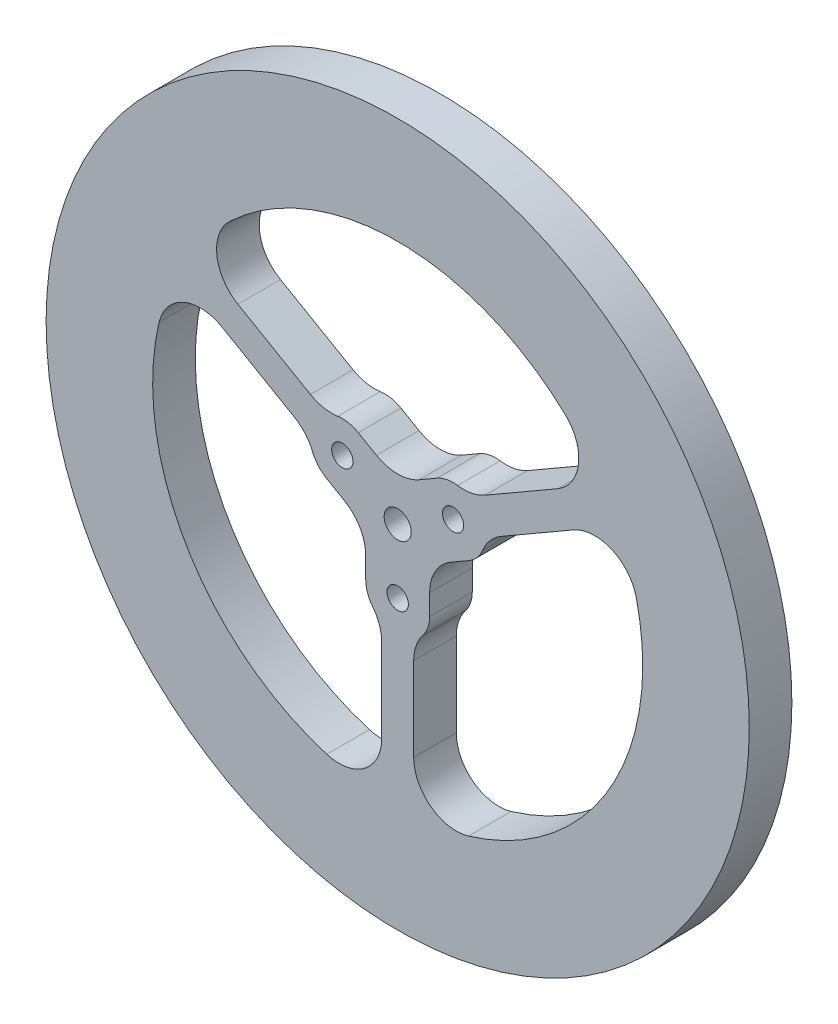
from build123d import *
from build123d.topology import SkipClean

# Parameters (mm, degrees)
BOSS_EXTRUDE1_DEPTH              = 3.175
BOSS_EXTRUDE1_DEPTH_BACK         = 3.175
SKETCH1_R                        = 52.3875
SKETCH1_R_2                      = 2.0193
SHAFT_COUPLER_BOLT_D             = 3.175
SHAFT_COUPLER_BOLT_PATTERN_COUNT = 3
SKETCH6_R                        = 36.5125
CUT_EXTRUDE2_DEPTH               = 2
VOID_CUT_DEPTH                   = 75.214707521
VOID_CUT_DEPTH_BACK              = 75.214707521
TOOLING_RADIUS_R                 = 6.35
BOSS_EXTRUDE2_START              = -4.35
BOSS_EXTRUDE2_DEPTH              = 6.35


# Read off the part's stored shape, not the designer's step: Boss-Extrude2
with BuildPart() as part:
    # Sketch1 → Boss-Extrude1 (new, two sides: drawn at the far end of the back side and taken through both)
    with BuildSketch(Plane.XY.offset(-BOSS_EXTRUDE1_DEPTH_BACK)):
        Circle(SKETCH1_R)
        Circle(SKETCH1_R_2, mode=Mode.SUBTRACT)
    extrude(amount=BOSS_EXTRUDE1_DEPTH + BOSS_EXTRUDE1_DEPTH_BACK)

    # SHAFT-COUPLER-BOLT (through all)
    with Locations(Plane.XY.offset(3.175)):
        with Locations((0, -9.525)):
            shaft_coupler_bolt = Hole(SHAFT_COUPLER_BOLT_D / 2)

    # SHAFT-COUPLER-BOLT-PATTERN: SHAFT-COUPLER-BOLT ×3 about axis
    shaft_coupler_bolt_pattern_axis = Axis((0, 0, 0), (0, 0, 1))
    for i in range(1, SHAFT_COUPLER_BOLT_PATTERN_COUNT):
        add(shaft_coupler_bolt.rotate(shaft_coupler_bolt_pattern_axis, i * 360 / SHAFT_COUPLER_BOLT_PATTERN_COUNT), mode=Mode.SUBTRACT)

    # Sketch6 → Cut-Extrude2 (cut)
    with BuildSketch(Plane.XY.offset(3.175)):
        Circle(SKETCH6_R)
        with BuildLine():
            Line((4.7625, -9.525), (4.7625, -2.749630657))
            Line((4.7625, -2.749630657), (10.630141971, 0.638054014))
            ThreePointArc((10.630141971, 0.638054014), (12.373337957, 7.14375), (5.867641971, 8.886945986))
            Line((5.867641971, 8.886945986), (0, 5.499261314))
            Line((0, 5.499261314), (-5.867641971, 8.886945986))
            ThreePointArc((-5.867641971, 8.886945986), (-12.373337957, 7.14375), (-10.630141971, 0.638054014))
            Line((-10.630141971, 0.638054014), (-4.7625, -2.749630657))
            Line((-4.7625, -2.749630657), (-4.7625, -9.525))
            ThreePointArc((-4.7625, -9.525), (0, -14.2875), (4.7625, -9.525))
        make_face(mode=Mode.SUBTRACT)
    cut_extrude2 = extrude(amount=-CUT_EXTRUDE2_DEPTH, mode=Mode.SUBTRACT)

    # Mirror1: Cut-Extrude2 across plane
    add(cut_extrude2.mirror(Plane.XY), mode=Mode.SUBTRACT)

    # Sketch7 → VOID-CUT (cut, two sides: drawn at the far end of the back side and taken through both)
    with BuildSketch(Plane.XY.offset(1.175).offset(-VOID_CUT_DEPTH_BACK)):
        with BuildLine():
            Line((2.38125, -13.649445986), (2.38125, -36.434767801))
            ThreePointArc((2.38125, -36.434767801), (26.646838901, -24.962143995), (36.5125, 0))
            ThreePointArc((36.5125, 0), (35.557911417, 8.294431382), (32.744059496, 16.155160908))
            Line((32.744059496, 16.155160908), (13.011391971, 4.7625))
            ThreePointArc((13.011391971, 4.7625), (12.373337957, 2.38125), (10.630141971, 0.638054014))
            Line((10.630141971, 0.638054014), (4.7625, -2.749630657))
            Line((4.7625, -2.749630657), (4.7625, -9.525))
            ThreePointArc((4.7625, -9.525), (4.124445986, -11.90625), (2.38125, -13.649445986))
        make_face()
        with BuildLine():
            ThreePointArc((-32.744059496, 16.155160908), (-31.620752556, -18.25625), (-2.38125, -36.434767801))
            Line((-2.38125, -36.434767801), (-2.38125, -13.649445986))
            ThreePointArc((-2.38125, -13.649445986), (-4.124445986, -11.90625), (-4.7625, -9.525))
            Line((-4.7625, -9.525), (-4.7625, -2.749630657))
            Line((-4.7625, -2.749630657), (-10.630141971, 0.638054014))
            ThreePointArc((-10.630141971, 0.638054014), (-12.373337957, 2.38125), (-13.011391971, 4.7625))
            Line((-13.011391971, 4.7625), (-32.744059496, 16.155160908))
        make_face()
        with BuildLine():
            ThreePointArc((30.362809496, 20.279606893), (0, 36.5125), (-30.362809496, 20.279606893))
            Line((-30.362809496, 20.279606893), (-10.630141971, 8.886945986))
            ThreePointArc((-10.630141971, 8.886945986), (-8.248891971, 9.525), (-5.867641971, 8.886945986))
            Line((-5.867641971, 8.886945986), (0, 5.499261314))
            Line((0, 5.499261314), (5.867641971, 8.886945986))
            ThreePointArc((5.867641971, 8.886945986), (8.248891971, 9.525), (10.630141971, 8.886945986))
            Line((10.630141971, 8.886945986), (30.362809496, 20.279606893))
        make_face()
    extrude(amount=VOID_CUT_DEPTH + VOID_CUT_DEPTH_BACK, mode=Mode.SUBTRACT)

    # TOOLING-RADIUS
    # the kernel refuses this fillet: 6.35 mm, written as the material it adds along each edge
    with BuildSketch(Plane(origin=(32.744059496, 16.155160908, 1.175), x_dir=(0.3373763569350217, -0.9413698496240746, 0), z_dir=(0, 0, -1)), Plane(origin=(30.362809496, 20.279606893, -1.175), x_dir=(-0.6465620256636754, 0.7628614205540117, 0), z_dir=(0, 0, 1)), Plane(origin=(-32.744059496, 16.155160908, -1.175), x_dir=(-0.3373763569350221, -0.9413698496240744, 0), z_dir=(0, 0, 1)), Plane(origin=(-2.38125, -36.434767801, 1.175), x_dir=(-0.9839383825986964, 0.17850842907006217, 0), z_dir=(0, 0, -1))) as tooling_radius_piece_1:
        with BuildLine():
            CenterArc((7.598183278, 6.308632991), TOOLING_RADIUS_R, 169.717107938, 106.826448893)
            Line((1.350174548, 7.442161515), (0, 0))
            ThreePointArc((0, 0), (4.16090989, -0.237860303), (8.32181978, 0))
        make_face()
    extrude(amount=2.35)
    with BuildSketch(Plane(origin=(2.38125, -36.434767801, 1.175), x_dir=(0.9839383825986963, 0.17850842907006276, 0), z_dir=(0, 0, -1)), Plane(origin=(-30.362809496, 20.279606893, -1.175), x_dir=(0.6465620256636744, 0.7628614205540126, 0), z_dir=(0, 0, 1))) as tooling_radius_piece_2:
        with BuildLine():
            CenterArc((7.598183278, -6.308632991), TOOLING_RADIUS_R, 83.456443169, 106.826448893)
            Line((1.350174548, -7.442161515), (0, 0))
            ThreePointArc((0, 0), (4.16090989, 0.237860303), (8.32181978, 0))
        make_face()
    extrude(amount=2.35)
    with BuildSketch(Plane(origin=(2.38125, -13.649445986, -1.175), x_dir=(0, -1, 0), z_dir=(0, 0, 1)), Plane(origin=(13.011391971, 4.7625, 1.175), x_dir=(0.866025403784439, 0.4999999999999993, 0), z_dir=(0, 0, -1)), Plane(origin=(-13.011391971, 4.7625, -1.175), x_dir=(-0.8660254037844386, 0.5000000000000001, 0), z_dir=(0, 0, 1)), Plane(origin=(-2.38125, -13.649445986, 1.175), x_dir=(0, -1, 0), z_dir=(0, 0, -1))) as tooling_radius_piece_3:
        with BuildLine():
            CenterArc((2.749630657, 6.35), TOOLING_RADIUS_R, 231.786789298, 38.213210702)
            ThreePointArc((-1.178413139, 1.360714286), (-0.52433438, 0.736538107), (0, 0))
            Line((0, 0), (2.749630657, 0))
        make_face()
    extrude(amount=2.35)
    with BuildSketch(Plane(origin=(10.630141971, 8.886945986, 1.175), x_dir=(0.8660254037844393, 0.4999999999999988, 0), z_dir=(0, 0, -1)), Plane(origin=(-10.630141971, 8.886945986, -1.175), x_dir=(-0.8660254037844384, 0.5000000000000004, 0), z_dir=(0, 0, 1))) as tooling_radius_piece_4:
        with BuildLine():
            CenterArc((2.749630657, -6.35), TOOLING_RADIUS_R, 90, 38.213210702)
            ThreePointArc((-1.178413139, -1.360714286), (-0.52433438, -0.736538107), (0, 0))
            Line((0, 0), (2.749630657, 0))
        make_face()
    extrude(amount=2.35)
    with BuildSketch(Plane(origin=(-4.7625, -2.749630657, -1.175), x_dir=(-0.8660254037844364, 0.5000000000000039, 0), z_dir=(0, 0, 1)), Plane(origin=(4.7625, -2.749630657, -1.175), x_dir=(0, -1, 0), z_dir=(0, 0, 1))) as tooling_radius_piece_5:
        with BuildLine():
            CenterArc((TOOLING_RADIUS_R * 0.57735026919, TOOLING_RADIUS_R), TOOLING_RADIUS_R, 210, 60)
            Line((-TOOLING_RADIUS_R * 0.288675134595, TOOLING_RADIUS_R * 0.5), (0, 0))
            Line((0, 0), (TOOLING_RADIUS_R * 0.57735026919, 0))
        make_face()
    extrude(amount=2.35)
    with BuildSketch(Plane(origin=(0, 5.499261314, 1.175), x_dir=(0.8660254037844363, 0.5000000000000041, 0), z_dir=(0, 0, -1))) as tooling_radius_piece_6:
        with BuildLine():
            CenterArc((TOOLING_RADIUS_R * 0.57735026919, -TOOLING_RADIUS_R), TOOLING_RADIUS_R, 90, 60)
            Line((-TOOLING_RADIUS_R * 0.288675134595, -TOOLING_RADIUS_R * 0.5), (0, 0))
            Line((0, 0), (TOOLING_RADIUS_R * 0.57735026919, 0))
        make_face()
    extrude(amount=2.35)
    with BuildSketch(Plane(origin=(4.7625, -2.749630657, -3.175), x_dir=(0.8660254037844362, 0.5000000000000043, 0), z_dir=(0, 0, 1)), Plane(origin=(0, 5.499261314, -3.175), x_dir=(-0.8660254037844383, 0.5000000000000009, 0), z_dir=(0, 0, 1)), Plane(origin=(-4.7625, -2.749630657, -3.175), x_dir=(0, -1, 0), z_dir=(0, 0, 1))) as tooling_radius_piece_7:
        with BuildLine():
            CenterArc((TOOLING_RADIUS_R * 0.57735026919, -TOOLING_RADIUS_R), TOOLING_RADIUS_R, 90, 60)
            Line((-TOOLING_RADIUS_R * 0.288675134595, -TOOLING_RADIUS_R * 0.5), (0, 0))
            Line((0, 0), (TOOLING_RADIUS_R * 0.57735026919, 0))
        make_face()
    extrude(amount=2)
    with BuildSketch(Plane(origin=(4.7625, -2.749630657, 3.175), x_dir=(0.8660254037844362, 0.5000000000000043, 0), z_dir=(0, 0, -1)), Plane(origin=(0, 5.499261314, 3.175), x_dir=(-0.8660254037844383, 0.5000000000000009, 0), z_dir=(0, 0, -1)), Plane(origin=(-4.7625, -2.749630657, 3.175), x_dir=(0, -1, 0), z_dir=(0, 0, -1))) as tooling_radius_piece_8:
        with BuildLine():
            CenterArc((TOOLING_RADIUS_R * 0.57735026919, TOOLING_RADIUS_R), TOOLING_RADIUS_R, 210, 60)
            Line((-TOOLING_RADIUS_R * 0.288675134595, TOOLING_RADIUS_R * 0.5), (0, 0))
            Line((0, 0), (TOOLING_RADIUS_R * 0.57735026919, 0))
        make_face()
    extrude(amount=2)

    # Boss-Extrude2 outline → Boss-Extrude2 (add)
    with SkipClean():  # the faces are left unmerged after this step: merging them gives an invalid solid
        with BuildSketch(Plane(origin=(0, 0, -1.175), x_dir=(-1, 0, 0), z_dir=(0, 0, -1)).offset(BOSS_EXTRUDE2_START)):
            with BuildLine():
                ThreePointArc((-3.741964286, -12.471032847), (-2.731063991, -14.320551238), (-2.38125, -16.399076643))
                Line((-2.38125, -16.399076643), (-2.38125, -28.871121899))
                ThreePointArc((-2.38125, -28.871121899), (-4.94639879, -33.969886584), (-10.569407895, -34.949252825))
                ThreePointArc((-10.569407895, -34.949252825), (0, -36.5125), (10.569407895, -34.949252825))
                ThreePointArc((10.569407895, -34.949252825), (4.94639879, -33.969886584), (2.38125, -28.871121899))
                Line((2.38125, -28.871121899), (2.38125, -16.399076643))
                ThreePointArc((2.38125, -16.399076643), (2.731063991, -14.320551238), (3.741964286, -12.471032847))
                ThreePointArc((3.741964286, -12.471032847), (0, -14.2875), (-3.741964286, -12.471032847))
            make_face()
            with BuildLine():
                ThreePointArc((-24.982236842, 26.628002152), (-31.620752556, 18.25625), (-35.551644737, 8.321250673))
                ThreePointArc((-35.551644737, 8.321250673), (-31.89198414, 12.701236283), (-26.19375, 12.373337957))
                Line((-26.19375, 12.373337957), (-15.392641971, 6.137315329))
                ThreePointArc((-15.392641971, 6.137315329), (-13.767493164, 4.795104823), (-12.6712134, 2.994880292))
                ThreePointArc((-12.6712134, 2.994880292), (-12.373337957, 7.14375), (-8.929249114, 9.476152555))
                ThreePointArc((-8.929249114, 9.476152555), (-11.036429173, 9.525446415), (-13.011391971, 10.261761314))
                Line((-13.011391971, 10.261761314), (-23.8125, 16.497783942))
                ThreePointArc((-23.8125, 16.497783942), (-26.945585351, 21.268650301), (-24.982236842, 26.628002152))
            make_face()
            with BuildLine():
                ThreePointArc((35.551644737, 8.321250673), (31.620752556, 18.25625), (24.982236842, 26.628002152))
                ThreePointArc((24.982236842, 26.628002152), (26.945585351, 21.268650301), (23.8125, 16.497783942))
                Line((23.8125, 16.497783942), (13.011391971, 10.261761314))
                ThreePointArc((13.011391971, 10.261761314), (11.036429173, 9.525446415), (8.929249114, 9.476152555))
                ThreePointArc((8.929249114, 9.476152555), (12.373337957, 7.14375), (12.6712134, 2.994880292))
                ThreePointArc((12.6712134, 2.994880292), (13.767493164, 4.795104823), (15.392641971, 6.137315329))
                Line((15.392641971, 6.137315329), (26.19375, 12.373337957))
                ThreePointArc((26.19375, 12.373337957), (31.89198414, 12.701236283), (35.551644737, 8.321250673))
            make_face()
        extrude(amount=BOSS_EXTRUDE2_DEPTH)
    add(part.part.scale(1), mode=Mode.REPLACE)  # the faces are merged on a copy


solid = part.part
